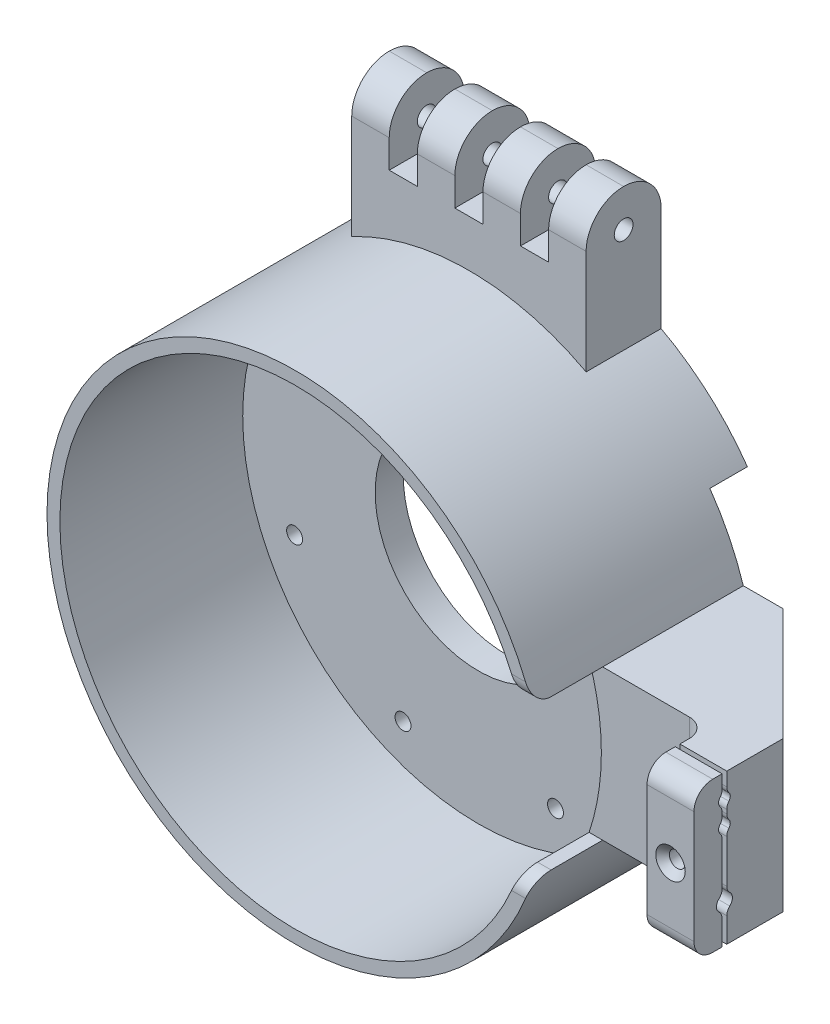
from build123d import *

# Parameters (mm, degrees)
SKETCH1_R               = 53
BOSS_EXTRUDE2_DEPTH     = 45
SKETCH2_R               = 50.25
CUT_EXTRUDE1_DEPTH      = 39
SKETCH4_R               = 22
CUT_EXTRUDE3_DEPTH      = 39
BOSS_EXTRUDE3_START     = 8
BOSS_EXTRUDE3_DEPTH     = 8
CUT_EXTRUDE5_DEPTH      = 10
CUT_EXTRUDE5_DEPTH_BACK = 10
SKETCH10_R              = 1.7
BOSS_EXTRUDE6_START     = -8
BOSS_EXTRUDE6_DEPTH     = 16
SKETCH13_W              = 8
SKETCH13_H              = 16
BOSS_EXTRUDE7_DEPTH     = 14
FILLET1_R               = 8
LPATTERN1_COUNT         = 4
LPATTERN1_PITCH         = 14
FILLET1_OF_LPATTERN1_R  = 8
CUT_EXTRUDE6_DEPTH      = 119.482066153
CUT_EXTRUDE6_DEPTH_BACK = 119.482066153
SKETCH14_R              = 2
CHAMFER1_SIZE           = 1.6
SKETCH15_W              = 15
SKETCH15_H              = 32
CUT_EXTRUDE7_DEPTH      = 10
BOSS_EXTRUDE8_START     = -2.47278
SKETCH17_W              = 30
SKETCH17_H              = 32
BOSS_EXTRUDE8_DEPTH     = 32.47278
CHAMFER2_SIZE           = 24
BOSS_EXTRUDE9_DEPTH     = 10
SKETCH25_R              = 1.4
CUT_EXTRUDE9_DEPTH      = 122.466044638
FILLET2_R               = 2
FILLET3_R               = 2
FILLET4_R               = 4
FILLET5_R               = 4
FILLET6_R               = 4


# Read off the part's stored shape, not the designer's step: Boss-Extrude6
with BuildPart() as part:
    # Sketch1 → Boss-Extrude2 (new body)
    with BuildSketch(Plane.XY):
        with Locations(Location((0, 0, 0), (0, 0, 180))):
            Circle(SKETCH1_R)
    extrude(amount=BOSS_EXTRUDE2_DEPTH)

    # Sketch2 → Cut-Extrude1 (cut)
    with BuildSketch(Plane.XY.offset(45)):
        Circle(SKETCH2_R)
    extrude(amount=-CUT_EXTRUDE1_DEPTH, mode=Mode.SUBTRACT)

    # Sketch4 → Cut-Extrude3 (cut)
    with BuildSketch(Plane(origin=(0, 0, 0), x_dir=(-1, 0, 0), z_dir=(0, 0, -1))):
        Circle(SKETCH4_R)
    extrude(amount=-CUT_EXTRUDE3_DEPTH, mode=Mode.SUBTRACT)

    # Sketch5 → Boss-Extrude3 (add)
    with BuildSketch(Plane(origin=(0, 0, 0), x_dir=(-1, 0, 0), z_dir=(0, 0, -1)).offset(BOSS_EXTRUDE3_START)):
        with BuildLine():
            Line((19.052558883, 11), (51.845925587, 11))
            ThreePointArc((51.845925587, 11), (10.588828865, 51.931461594), (-43.400241675, 30.42070056))
            Line((-43.400241675, 30.42070056), (-16.397830673, 14.666667965))
            ThreePointArc((-16.397830673, 14.666667965), (2.263406494, 21.883258236), (19.052558883, 11))
        make_face()
    extrude(amount=-BOSS_EXTRUDE3_DEPTH)

    # Sketch10 → Cut-Extrude5 (cut, two sides: drawn at the far end of the back side and taken through both)
    with BuildSketch(Plane(origin=(0, 0, 0), x_dir=(-1, 0, 0), z_dir=(0, 0, -1)).offset(-CUT_EXTRUDE5_DEPTH_BACK)):
        with Locations(Location((-39.35, -16.057007816, 0), (0, 0, 180))):
            Circle(SKETCH10_R)
        with Locations(Location((-39.178670952, 16.470632727, 0), (0, 0, 180))):
            Circle(SKETCH10_R)
        with Locations(Location((-16.057007816, 39.35, 0), (0, 0, 180))):
            Circle(SKETCH10_R)
        with Locations(Location((16.470632727, 39.178670952, 0), (0, 0, 180))):
            Circle(SKETCH10_R)
        with Locations(Location((39.35, 16.057007816, 0), (0, 0, 180))):
            Circle(SKETCH10_R)
        with Locations(Location((39.178670952, -16.470632727, 0), (0, 0, 180))):
            Circle(SKETCH10_R)
        with Locations(Location((16.057007816, -39.35, 0), (0, 0, 180))):
            Circle(SKETCH10_R)
        with Locations(Location((-16.470632728, -39.178670952, 0), (0, 0, 180))):
            Circle(SKETCH10_R)
    extrude(amount=CUT_EXTRUDE5_DEPTH + CUT_EXTRUDE5_DEPTH_BACK, mode=Mode.SUBTRACT)

    # Boss-Extrude6 outline → Boss-Extrude6 (add)
    with BuildSketch(Plane.XY.offset(BOSS_EXTRUDE6_START)):
        with BuildLine():
            Line((-25, 63), (-25, 46.733285782))
            ThreePointArc((-25, 46.733285782), (0, 53), (25, 46.733285782))
            Line((25, 46.733285782), (25, 63))
            Line((25, 63), (-25, 63))
        make_face()
    extrude(amount=BOSS_EXTRUDE6_DEPTH)

    # Sketch13 → Boss-Extrude7 (add)
    with BuildSketch(Plane(origin=(0, 63, 0), x_dir=(1, 0, 0), z_dir=(0, 1, 0))):
        with Locations((21, 0)):
            Rectangle(SKETCH13_W, SKETCH13_H)
    boss_extrude7 = extrude(amount=BOSS_EXTRUDE7_DEPTH)

    # Fillet1
    fillet1_edges = [part.edges().sort_by_distance(p)[0] for p in [
        (21, 77, 8),
        (21, 77, -8),
    ]]
    fillet(fillet1_edges, radius=FILLET1_R - 0.0001)  # a hair under: the kernel refuses the full size

    # LPattern1: Boss-Extrude7 ×4
    with Locations(*[(-i * LPATTERN1_PITCH, 0, 0) for i in range(1, LPATTERN1_COUNT)]):
        add(boss_extrude7)

    # Fillet1 of LPattern1
    fillet1_of_lpattern1_edges = [part.edges().sort_by_distance(p)[0] for p in [
        (7, 77, 8),
        (7, 77, -8),
        (-7, 77, 8),
        (-7, 77, -8),
        (-21, 77, 8),
        (-21, 77, -8),
    ]]
    fillet(fillet1_of_lpattern1_edges, radius=FILLET1_OF_LPATTERN1_R - 0.0001)  # a hair under: the kernel refuses the full size

    # Sketch14 → Cut-Extrude6 (cut, two sides: drawn at the far end of the back side and taken through both)
    with BuildSketch(Plane(origin=(25, 0, 0), x_dir=(0, 0, -1), z_dir=(1, 0, 0)).offset(-CUT_EXTRUDE6_DEPTH_BACK)):
        with Locations((0, 69)):
            Circle(SKETCH14_R)
    extrude(amount=CUT_EXTRUDE6_DEPTH + CUT_EXTRUDE6_DEPTH_BACK, mode=Mode.SUBTRACT)

    # Chamfer1
    chamfer1_edges = [part.edges().sort_by_distance(p)[0] for p in [
        (14.770632728, -39.178670952, 0),
        (-17.757007816, -39.35, 0),
        (-40.878670952, -16.470632727, 0),
        (-41.05, 16.057007816, -8),
        (-18.170632727, 39.178670952, -8),
        (14.357007816, 39.35, -8),
        (37.478670952, 16.470632727, 0),
        (37.65, -16.057007816, 0),
    ]]
    chamfer(chamfer1_edges, length=CHAMFER1_SIZE)

    # Sketch15 → Cut-Extrude7 (cut)
    with BuildSketch(Plane(origin=(53, 0, 0), x_dir=(0, 0, -1), z_dir=(1, 0, 0))):
        with Locations((-37.5, 0)):
            Rectangle(SKETCH15_W, SKETCH15_H)
    extrude(amount=-CUT_EXTRUDE7_DEPTH, mode=Mode.SUBTRACT)

    # Sketch17 → Boss-Extrude8 (add)
    with BuildSketch(Plane(origin=(53, 0, 0), x_dir=(0, 0, -1), z_dir=(1, 0, 0)).offset(BOSS_EXTRUDE8_START)):
        with Locations((-15, 0)):
            Rectangle(SKETCH17_W, SKETCH17_H)
    extrude(amount=BOSS_EXTRUDE8_DEPTH)

    # Chamfer2
    chamfer2_edges = [part.edges().sort_by_distance(p)[0] for p in [
        (83, 0, 0),
    ]]
    chamfer(chamfer2_edges, length=CHAMFER2_SIZE)

    # Sketch18 → Boss-Extrude9 (add)
    with BuildSketch(Plane(origin=(83, 0, 0), x_dir=(0, 0, -1), z_dir=(1, 0, 0))):
        with BuildLine():
            Line((-36, -16), (-30, -16))
            Line((-30, -16), (-30, 16))
            Line((-30, 16), (-36, 16))
            Line((-36, 16), (-36, 12.145643924))
            ThreePointArc((-36, 12.145643924), (-35.25, 11), (-36, 9.854356076))
            Line((-36, 9.854356076), (-36, 7.145643924))
            ThreePointArc((-36, 7.145643924), (-35.25, 6), (-36, 4.854356076))
            Line((-36, 4.854356076), (-36, -6.375192319))
            ThreePointArc((-36, -6.375192319), (-34.8, -8), (-36, -9.624807681))
            Line((-36, -9.624807681), (-36, -16))
        make_face()
        with BuildLine():
            Line((-37, -16), (-43, -16))
            Line((-43, -16), (-43, 16))
            Line((-43, 16), (-37, 16))
            Line((-37, 16), (-37, 12.145643924))
            ThreePointArc((-37, 12.145643924), (-37.75, 11), (-37, 9.854356076))
            Line((-37, 9.854356076), (-37, 7.145643924))
            ThreePointArc((-37, 7.145643924), (-37.75, 6), (-37, 4.854356076))
            Line((-37, 4.854356076), (-37, -6.375192319))
            ThreePointArc((-37, -6.375192319), (-38.2, -8), (-37, -9.624807681))
            Line((-37, -9.624807681), (-37, -16))
        make_face()
    extrude(amount=-BOSS_EXTRUDE9_DEPTH)


with BuildPart() as boss_extrude9_piece_1:
    # of the separate pieces the step leaves, piece 1, a body of its own (boss_extrude9_pieces)
    add(part.part.solids().sort_by_distance((59, 16, 0))[0])

    # Sketch25 → Cut-Extrude9 (cut, through all)
    with BuildSketch(Plane.XY.offset(36)):
        with Locations((78, 0)):
            Circle(SKETCH25_R)
    extrude(amount=-CUT_EXTRUDE9_DEPTH, mode=Mode.SUBTRACT)

    # Fillet2
    fillet2_edges = [boss_extrude9_piece_1.edges().sort_by_distance(p)[0] for p in [
        (78, -9.624807681, 36),
        (78, -6.375192319, 36),
        (78, 4.854356076, 36),
        (78, 7.145643924, 36),
        (78, 9.854356076, 36),
        (78, 12.145643924, 36),
    ]]
    fillet(fillet2_edges, radius=FILLET2_R)

    # Fillet4
    fillet4_edges = [boss_extrude9_piece_1.edges().sort_by_distance(p)[0] for p in [
        (73, 0, 30),
    ]]
    fillet(fillet4_edges, radius=FILLET4_R)

    # Fillet5
    fillet5_edges = [boss_extrude9_piece_1.edges().sort_by_distance(p)[0] for p in [
        (49.080948941, -16, 45),
        (49.080948941, 16, 45),
    ]]
    fillet(fillet5_edges, radius=FILLET5_R)


with BuildPart() as boss_extrude9_piece_2:
    # of the separate pieces the step leaves, piece 2, a body of its own (boss_extrude9_pieces)
    add(part.part.solids().sort_by_distance((83, -9.624807681, 37))[0])

    # Sketch22 → CSK for M3 Countersunk Flat Head Screw1 (revolve, cut)
    with BuildSketch(Plane(origin=(78, 0, 43), x_dir=(0, -1, 0), z_dir=(1, 0, 0))):
        Polygon((0, 0), (0, 24), (1.7, 24), (1.7, 1.45), (3.15, 0), align=None)
    revolve(axis=Axis((78, 0, 49.35), (0, 0, -1)), mode=Mode.SUBTRACT)

    # Fillet3
    fillet3_edges = [boss_extrude9_piece_2.edges().sort_by_distance(p)[0] for p in [
        (78, 12.145643924, 37),
        (78, 9.854356076, 37),
        (78, 7.145643924, 37),
        (78, 4.854356076, 37),
        (78, -6.375192319, 37),
        (78, -9.624807681, 37),
    ]]
    fillet(fillet3_edges, radius=FILLET3_R)

    # Fillet6
    fillet6_edges = [boss_extrude9_piece_2.edges().sort_by_distance(p)[0] for p in [
        (78, -16, 43),
        (78, 16, 43),
    ]]
    fillet(fillet6_edges, radius=FILLET6_R)


solid = Compound([boss_extrude9_piece_1.part, boss_extrude9_piece_2.part])
